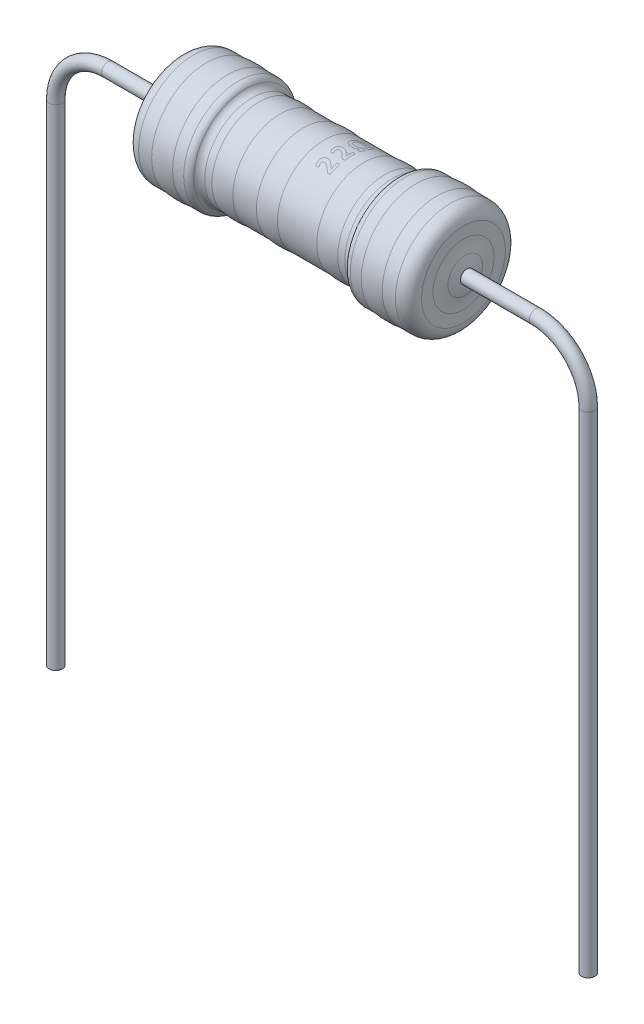
from build123d import *

# Parameters (mm, degrees)
SKETCH_WIRE_DIAMETER_R = 0.25
FILLET1_R              = 0.3
FILLET2_R              = 2


with BuildPart() as part:
    # SET WIRE LENGTH: sweep along a path in Sketch Set Wire Width
    with BuildLine(Plane.XY) as set_wire_length_path:
        Line((-10.16, -20.698407346), (-10.16, -2))
        ThreePointArc((-10.16, -2), (-9.574213562, -0.585786438), (-8.16, 0))
        Line((-8.16, 0), (8.16, 0))
        ThreePointArc((8.16, 0), (9.574213562, -0.585786438), (10.16, -2))
        Line((10.16, -2), (10.16, -20.698407346))
    # Sketch Wire Diameter → SET WIRE LENGTH (sweep)
    with BuildSketch(Plane(origin=(0, 0, 0), x_dir=(0, 0, -1), z_dir=(1, 0, 0))):
        Circle(SKETCH_WIRE_DIAMETER_R)
    sweep(path=set_wire_length_path.line)


with BuildPart() as body_2:
    # Sketch3 → Revolve2 (revolve)
    with BuildSketch(Plane.XY):
        with BuildLine():
            Line((-5.4, 0), (5.4, 0))
            Line((5.4, 0), (5.4, 1.6))
            ThreePointArc((5.4, 1.6), (5.253553391, 1.953553391), (4.9, 2.1))
            Line((4.9, 2.1), (3.18, 2.1))
            ThreePointArc((3.18, 2.1), (2.982010101, 2.017989899), (2.9, 1.82))
            Line((2.9, 1.82), (2.9, 1.8))
            Line((2.9, 1.8), (-2.9, 1.8))
            Line((-2.9, 1.8), (-2.9, 1.82))
            ThreePointArc((-2.9, 1.82), (-2.982010101, 2.017989899), (-3.18, 2.1))
            Line((-3.18, 2.1), (-4.9, 2.1))
            ThreePointArc((-4.9, 2.1), (-5.253553391, 1.953553391), (-5.4, 1.6))
            Line((-5.4, 1.6), (-5.4, 0))
        make_face()
    revolve(axis=Axis((-5.4, 0, 0), (1, 0, 0)))

    # Fillet1
    fillet1_edges = [body_2.edges().sort_by_distance(p)[0] for p in [
        (2.9, -1.8, 0),
        (-2.9, -1.8, 0),
    ]]
    fillet(fillet1_edges, radius=FILLET1_R)

    # Sketch5 → Band 1 (revolve)
    with BuildSketch(Plane.XY):
        with BuildLine():
            Line((-4.4, 2.1), (-3.6, 2.1))
            ThreePointArc((-3.6, 2.1), (-4, 2.13), (-4.4, 2.1))
        make_face()
    revolve(axis=Axis((-0.3, 0, 0), (-1, 0, 0)))

    # Sketch8 → Band 2 (revolve)
    with BuildSketch(Plane.XY):
        with BuildLine():
            Line((-2.4, 1.8), (-1.6, 1.8))
            ThreePointArc((-1.6, 1.8), (-2, 1.83), (-2.4, 1.8))
        make_face()
    revolve(axis=Axis((-0.3, 0, 0), (-1, 0, 0)))

    # Sketch9 → Band 3 (revolve)
    with BuildSketch(Plane.XY):
        with BuildLine():
            Line((-0.7, 1.8), (0.1, 1.8))
            ThreePointArc((0.1, 1.8), (-0.3, 1.83), (-0.7, 1.8))
        make_face()
    revolve(axis=Axis((-0.3, 0, 0), (-1, 0, 0)))

    # Sketch10 → Band 4 (revolve)
    with BuildSketch(Plane.XY):
        with BuildLine():
            Line((1.6, 1.8), (2.4, 1.8))
            ThreePointArc((2.4, 1.8), (2, 1.83), (1.6, 1.8))
        make_face()
    revolve(axis=Axis((0, 0, 0), (1, 0, 0)))

    # Sketch11 → Band 5 (revolve)
    with BuildSketch(Plane.XY):
        with BuildLine():
            Line((3.6, 2.1), (4.4, 2.1))
            ThreePointArc((4.4, 2.1), (4, 2.13), (3.6, 2.1))
        make_face()
    revolve(axis=Axis((2, 0, 0), (1, 0, 0)))

    # Sketch12 → Revolve10 (revolve)
    with BuildSketch(Plane.XY):
        with BuildLine():
            Line((-5.35, 1), (-5.35, 0))
            Line((-5.35, 0), (-5.55, 0))
            ThreePointArc((-5.55, 0), (-5.499509757, 0.509901951), (-5.35, 1))
        make_face()
        with BuildLine():
            Line((5.35, 1), (5.35, 0))
            Line((5.35, 0), (5.55, 0))
            ThreePointArc((5.55, 0), (5.499509757, 0.509901951), (5.35, 1))
        make_face()
    revolve(axis=Axis((-5.35, 0, 0), (1, 0, 0)))

    # Fillet2
    fillet2_edges = [body_2.edges().sort_by_distance(p)[0] for p in [
        (5.4, -0.870344759, 0),
        (-5.4, -0.870344759, 0),
    ]]
    fillet(fillet2_edges, radius=FILLET2_R)


solid = Compound([part.part, body_2.part])
